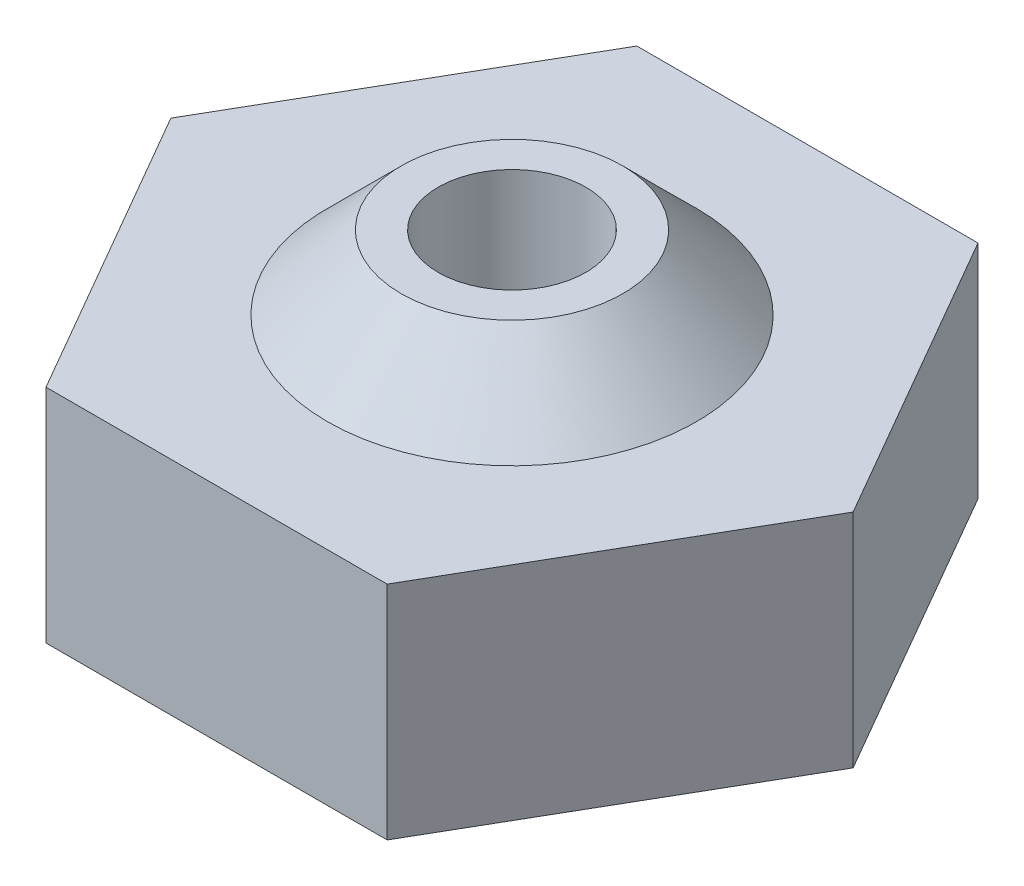
from build123d import *

# Parameters (mm, degrees)
BOSS_EXTRUDE1_DEPTH = 15
SKETCH2_R           = 12.5
BOSS_EXTRUDE2_DEPTH = 5
SKETCH3_R           = 5
CUT_EXTRUDE1_DEPTH  = 37.514837167
CHAMFER1_SIZE       = 5
SKETCH4_R           = 12.5
CUT_EXTRUDE2_DEPTH  = 5


with BuildPart() as part:
    # Sketch1 → Boss-Extrude1 (new body)
    with BuildSketch(Plane(origin=(0, 0, 0), x_dir=(1, 0, 0), z_dir=(0, 1, 0))):
        Polygon((11.547005384, 20), (-11.547005384, 20), (-23.094010768, 0), (-11.547005384, -20), (11.547005384, -20), (23.094010768, 0), align=None)
    extrude(amount=BOSS_EXTRUDE1_DEPTH)

    # Sketch2 → Boss-Extrude2 (add)
    with BuildSketch(Plane(origin=(0, 15, 0), x_dir=(1, 0, 0), z_dir=(0, 1, 0))):
        with Locations(Location((0, 0, 0), (0, 0, 270))):
            Circle(SKETCH2_R)
    extrude(amount=BOSS_EXTRUDE2_DEPTH)

    # Sketch3 → Cut-Extrude1 (cut, through all)
    with BuildSketch(Plane(origin=(0, 20, 0), x_dir=(1, 0, 0), z_dir=(0, 1, 0))):
        with Locations(Location((0, 0, 0), (0, 0, 270))):
            Circle(SKETCH3_R)
    extrude(amount=-CUT_EXTRUDE1_DEPTH, mode=Mode.SUBTRACT)

    # Chamfer1
    chamfer1_edges = [part.edges().sort_by_distance(p)[0] for p in [
        (0, 20, -12.5),
    ]]
    chamfer(chamfer1_edges, length=CHAMFER1_SIZE - 0.0001)  # a hair under: the kernel refuses the full size

    # Sketch4 → Cut-Extrude2 (cut)
    with BuildSketch(Plane.XZ):
        with Locations(Location((0, 0, 0), (0, 0, 270))):
            Circle(SKETCH4_R)
    extrude(amount=-CUT_EXTRUDE2_DEPTH, mode=Mode.SUBTRACT)


solid = part.part
